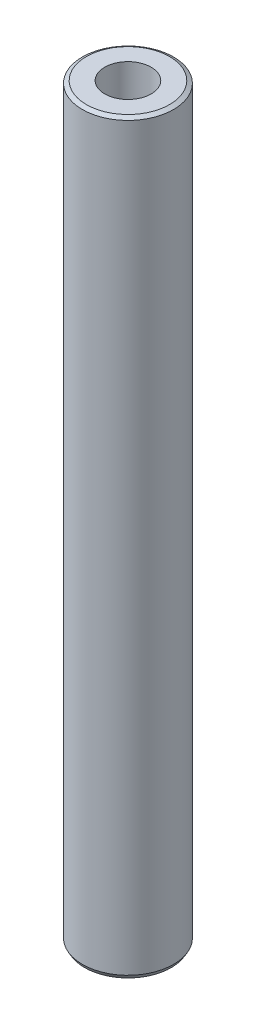
from build123d import *
from OCP.BRepFilletAPI import BRepFilletAPI_MakeChamfer

# Parameters (mm, degrees)
SKETCH1_R           = 10
BOSS_EXTRUDE1_DEPTH = 163.772081381
SKETCH2_R           = 5.091639401
CUT_EXTRUDE1_DEPTH  = 165.381552006
CHAMFER1_SIZE       = 0.504492776
CHAMFER1_SIZE2      = 0.87380712


with BuildPart() as part:
    # Sketch1 → Boss-Extrude1 (new body)
    with BuildSketch(Plane(origin=(0, 0, 0), x_dir=(1, 0, 0), z_dir=(0, 1, 0))):
        Circle(SKETCH1_R)
    extrude(amount=BOSS_EXTRUDE1_DEPTH)

    # Sketch2 → Cut-Extrude1 (cut, through all)
    with BuildSketch(Plane(origin=(0, 0, 0), x_dir=(1, 0, 0), z_dir=(0, 1, 0))):
        Circle(SKETCH2_R)
    extrude(amount=CUT_EXTRUDE1_DEPTH, mode=Mode.SUBTRACT)

    # Chamfer1: one chamfer whose edges measure the first distance from different faces: ONE call of the kernel's chamfer builder (chamfer() names one face for all edges)
    chamfer1_edges_1 = [part.edges().sort_by_distance(p)[0] for p in [
        (-10, 163.772081381, 0),
    ]]
    chamfer1_side_1 = [part.faces().sort_by_distance(p)[0] for p in [
        (-10, 81.88604069, 0),
    ]]
    chamfer1_edges_2 = [part.edges().sort_by_distance(p)[0] for p in [
        (-10, 0, 0),
    ]]
    chamfer1_side_2 = [part.faces().sort_by_distance(p)[0] for p in [
        (-9.717157288, 0, 0),
    ]]
    chamfer1 = BRepFilletAPI_MakeChamfer(part.part.solid().wrapped)
    for e in chamfer1_edges_1:
        chamfer1.Add(CHAMFER1_SIZE, CHAMFER1_SIZE2, e.wrapped, chamfer1_side_1[0].wrapped)  # the first distance lies on this face
    for e in chamfer1_edges_2:
        chamfer1.Add(CHAMFER1_SIZE, CHAMFER1_SIZE2, e.wrapped, chamfer1_side_2[0].wrapped)  # the first distance lies on this face
    add(Compound.cast(chamfer1.Shape()), mode=Mode.REPLACE)


solid = part.part
